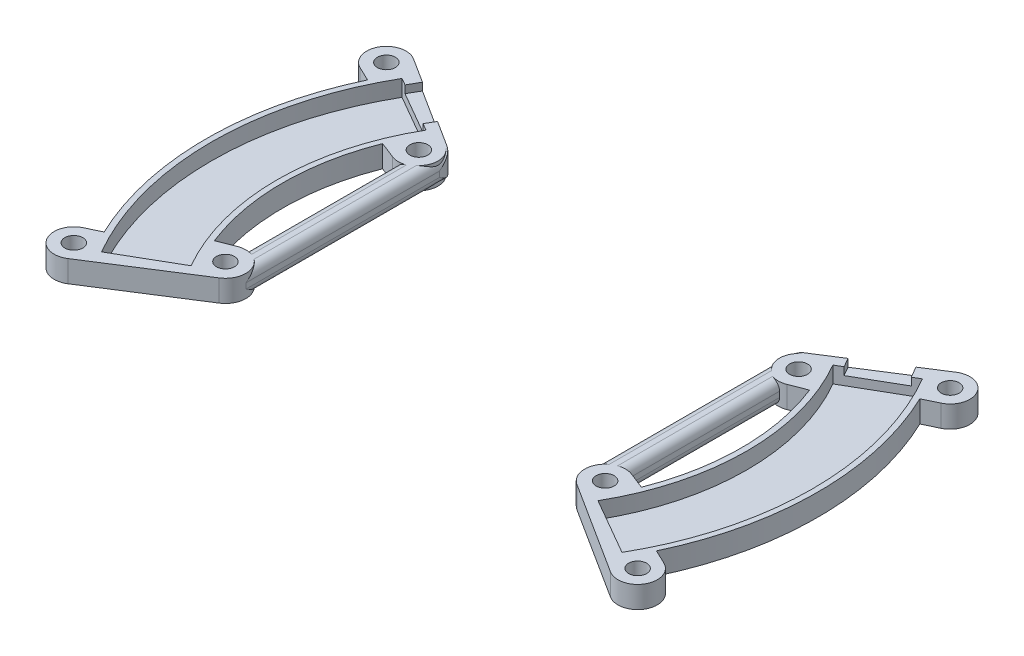
from build123d import *

# Parameters (mm, degrees)
SKETCH1_R                    = 1.65
BOSS_EXTRUDE1_DEPTH          = 4
CUT_REVOLVE1_ANGLE           = 30
CUT_REVOLVE1_OTHER_WAY_ANGLE = 30
FILLET2_R                    = 1.5
BOSS_EXTRUDE2_START          = -1e-06
SKETCH8_R                    = 3.737984348
SKETCH8_R_2                  = 1.65
SKETCH8_R_3                  = 3.5
BOSS_EXTRUDE2_DEPTH          = 4.000003
CUT_REVOLVE2_ANGLE           = 30
CUT_REVOLVE2_OTHER_WAY_ANGLE = 30
SKETCH11_W                   = 9
SKETCH11_H                   = 1.4
CUT_EXTRUDE1_DEPTH           = 10


with BuildPart() as part:
    # Sketch1 → Boss-Extrude1 (new body)
    # profile 1 of 2: a face of its own
    with BuildSketch(Plane(origin=(0, 0, 0), x_dir=(1, 0, 0), z_dir=(0, 1, 0))):
        with BuildLine():
            ThreePointArc((35.011270095, 13.9768395), (32.20041975, 14.971407718), (31.011270095, 17.70562949))
            Line((31.011270095, 17.70562949), (31.011270095, -17.70562949))
            ThreePointArc((31.011270095, -17.70562949), (32.20041975, -14.971407718), (35.011270095, -13.9768395))
            Line((35.011270095, -13.9768395), (35.011270095, 13.9768395))
        make_face()
    # profile 2 of 2: a face of its own
    with BuildSketch(Plane(origin=(0, 0, 0), x_dir=(1, 0, 0), z_dir=(0, 1, 0))):
        with BuildLine():
            ThreePointArc((32.740836917, 20.858213514), (31.418686002, 16.008620108), (36.119230292, 14.227743183))
            Line((36.119230292, 14.227743183), (39.077537855, 15.393051522))
            ThreePointArc((39.077537855, 15.393051522), (42, 0), (39.077537855, -15.393051522))
            Line((39.077537855, -15.393051522), (36.119230292, -14.227743183))
            ThreePointArc((36.119230292, -14.227743183), (31.418686002, -16.008620108), (32.740836917, -20.858213514))
            Line((32.740836917, -20.858213514), (49.667282695, -31.64154874))
            ThreePointArc((49.667282695, -31.64154874), (54.752823812, -30.349985831), (53.15320507, -25.352778303))
            Line((53.15320507, -25.352778303), (50.544775924, -24.108621421))
            ThreePointArc((50.544775924, -24.108621421), (56, 0), (50.544775924, 24.108621421))
            Line((50.544775924, 24.108621421), (53.15320507, 25.352778303))
            ThreePointArc((53.15320507, 25.352778303), (54.752823812, 30.349985831), (49.667282695, 31.64154874))
            Line((49.667282695, 31.64154874), (32.740836917, 20.858213514))
        make_face()
        with Locations(Location((34.749254443, -17.70562949, 0), (0, 0, 270))):
            Circle(SKETCH1_R, mode=Mode.SUBTRACT)
        with Locations(Location((34.749254443, 17.70562949, 0), (0, 0, 270))):
            Circle(SKETCH1_R, mode=Mode.SUBTRACT)
        with Locations(Location((51.602562721, 28.603767595, 0), (0, 0, 270))):
            Circle(SKETCH1_R, mode=Mode.SUBTRACT)
        with Locations(Location((51.602562721, -28.603767595, 0), (0, 0, 270))):
            Circle(SKETCH1_R, mode=Mode.SUBTRACT)
    extrude(amount=BOSS_EXTRUDE1_DEPTH)

    # Sketch7 → Cut-Revolve1 (revolve, cut)
    with BuildSketch(Plane.XY):
        Polygon((43, 4), (43, 3), (44, 3), (44, 1), (54, 1), (54, 3), (55, 3), (55, 4), align=None)
    revolve(axis=Axis((0, 4.2, 0), (0, -1, 0)), revolution_arc=CUT_REVOLVE1_ANGLE, mode=Mode.SUBTRACT)

    # Sketch7 → Cut-Revolve1 other way (revolve, cut)
    with BuildSketch(Plane.XY):
        Polygon((43, 4), (43, 3), (44, 3), (44, 1), (54, 1), (54, 3), (55, 3), (55, 4), align=None)
    revolve(axis=Axis((0, 4.2, 0), (0, 1, 0)), revolution_arc=CUT_REVOLVE1_OTHER_WAY_ANGLE, mode=Mode.SUBTRACT)

    # Fillet2
    # the kernel refuses this fillet: 1.5 mm, written as the material it takes off along each edge
    with BuildSketch(Plane(origin=(35.011270095, 4, 17.7268395), x_dir=(-1, 0, 0), z_dir=(0, 0, -1))) as fillet2_piece_1_section:
        with BuildLine():
            CenterArc((FILLET2_R, -FILLET2_R), FILLET2_R, 90, 90)
            Line((0, -FILLET2_R), (0, 0))
            Line((0, 0), (FILLET2_R, 0))
        make_face()
    fillet2_piece_1 = extrude(amount=35.453679001, mode=Mode.PRIVATE)
    fillet2_piece_1 = fillet2_piece_1 - Plane(origin=(34.749254443, 3.665091157, 17.70562949), x_dir=(0.36650122672429, 0, -0.9304175679820275), z_dir=(0, -1, 0)) * Cylinder(3.737984348, 77, mode=Mode.PRIVATE)
    fillet2_piece_1 = fillet2_piece_1 - Plane(origin=(34.749254443, 3.665091157, -17.70562949), x_dir=(-0.5372996083468184, 0, -0.8433914458128893), z_dir=(0, -1, 0)) * Cylinder(3.737984348, 77, mode=Mode.PRIVATE)
    add(fillet2_piece_1, mode=Mode.SUBTRACT)
    with BuildSketch(Plane(origin=(31.011270095, 0, -21.45562949), x_dir=(0, 1, 0), z_dir=(0, 0, 1)), Plane(origin=(31.011270095, 4, -21.45562949), x_dir=(1, 0, 0), z_dir=(0, 0, 1))) as fillet2_piece_2:
        with BuildLine():
            CenterArc((FILLET2_R, -FILLET2_R), FILLET2_R, 90, 90)
            Line((0, -FILLET2_R), (0, 0))
            Line((0, 0), (FILLET2_R, 0))
        make_face()
    extrude(amount=42.91125898, mode=Mode.SUBTRACT)
    with BuildSketch(Plane(origin=(35.011270095, 0, 17.7268395), x_dir=(0, 1, 0), z_dir=(0, 0, -1))) as fillet2_piece_3_section:
        with BuildLine():
            CenterArc((FILLET2_R, -FILLET2_R), FILLET2_R, 90, 90)
            Line((0, -FILLET2_R), (0, 0))
            Line((0, 0), (FILLET2_R, 0))
        make_face()
    fillet2_piece_3 = extrude(amount=35.453679001, mode=Mode.PRIVATE)
    fillet2_piece_3 = fillet2_piece_3 - Plane(origin=(34.749254443, 0.334908844, 17.70562949), x_dir=(0.36650122672429, 0, -0.9304175679820275), z_dir=(0, -1, 0)) * Cylinder(3.737984348, 77, mode=Mode.PRIVATE)
    fillet2_piece_3 = fillet2_piece_3 - Plane(origin=(34.749254443, 0.334908844, -17.70562949), x_dir=(-0.5372996083468184, 0, -0.8433914458128893), z_dir=(0, -1, 0)) * Cylinder(3.737984348, 77, mode=Mode.PRIVATE)
    add(fillet2_piece_3, mode=Mode.SUBTRACT)

    # Sketch8 → Boss-Extrude2 (add)
    # profile 1 of 2: a face of its own
    with BuildSketch(Plane(origin=(0, 0, 0), x_dir=(1, 0, 0), z_dir=(0, 1, 0)).offset(BOSS_EXTRUDE2_START)):
        with Locations((34.749254443, -17.70562949)):
            Circle(SKETCH8_R)
        with Locations(Location((34.749254443, -17.70562949, 0), (0, 0, 270))):
            Circle(SKETCH8_R_2, mode=Mode.SUBTRACT)
    # profile 2 of 2: a face of its own
    with BuildSketch(Plane(origin=(0, 0, 0), x_dir=(1, 0, 0), z_dir=(0, 1, 0)).offset(BOSS_EXTRUDE2_START)):
        with Locations((34.749254443, 17.70562949)):
            Circle(SKETCH8_R_3)
        with Locations(Location((34.749254443, 17.70562949, 0), (0, 0, 270))):
            Circle(SKETCH8_R_2, mode=Mode.SUBTRACT)
    extrude(amount=BOSS_EXTRUDE2_DEPTH)

    # Sketch9 → Cut-Revolve2 (revolve, cut)
    with BuildSketch(Plane.XY):
        Polygon((43, 4), (43, 3), (43, 1), (44, 1), (54, 1), (55, 1), (55, 3), (55, 4), align=None)
    revolve(axis=Axis((0, 4.2, 0), (0, -1, 0)), revolution_arc=CUT_REVOLVE2_ANGLE, mode=Mode.SUBTRACT)

    # Sketch9 → Cut-Revolve2 other way (revolve, cut)
    with BuildSketch(Plane.XY):
        Polygon((43, 4), (43, 3), (43, 1), (44, 1), (54, 1), (55, 1), (55, 3), (55, 4), align=None)
    revolve(axis=Axis((0, 4.2, 0), (0, 1, 0)), revolution_arc=CUT_REVOLVE2_OTHER_WAY_ANGLE, mode=Mode.SUBTRACT)

    # Sketch11 → Cut-Extrude1 (cut)
    with BuildSketch(Plane(origin=(0, 0, 0), x_dir=(0.8660254037844382, 0, -0.5000000000000011), z_dir=(0.5000000000000011, 0, 0.8660254037844382))):
        with Locations((49, 3.3)):
            Rectangle(SKETCH11_W, SKETCH11_H)
    extrude(amount=-CUT_EXTRUDE1_DEPTH, mode=Mode.SUBTRACT)


with BuildPart() as body_2:
    # Mirror2: mirrored copy
    add(part.part.mirror(Plane(origin=(0, 0, 0), x_dir=(0, 0, 1), z_dir=(1, 0, 0))))


solid = Compound([part.part, body_2.part])
